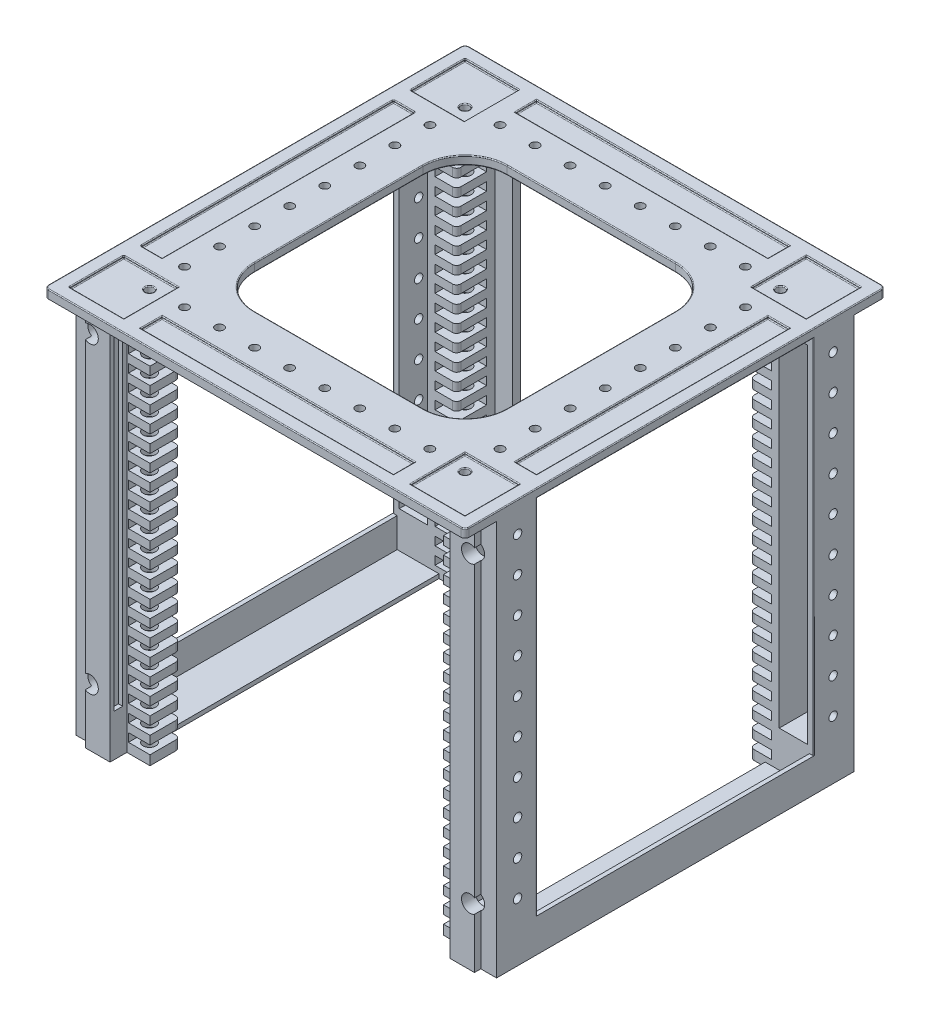
from build123d import *

# Parameters (mm, degrees)
BOSS_EXTRUDE1_DEPTH      = 94
BOSS_EXTRUDE1_2_DEPTH    = 94
BOSS_EXTRUDE1_3_DEPTH    = 94
BOSS_EXTRUDE1_4_DEPTH    = 94
SKETCH4_W                = 100
SKETCH4_H                = 100
BOSS_EXTRUDE2_DEPTH      = 2
FILLET1_R                = 1
SKETCH5_W                = 113.888332388
SKETCH5_H                = 6
CUT_EXTRUDE2_DEPTH       = 140
SKETCH8_W                = 80
SKETCH8_H                = 2
CUT_EXTRUDE5_DEPTH       = 84
LPATTERN1_COUNT          = 23
LPATTERN1_PITCH          = 4
CUT_EXTRUDE6_REACH       = 121.231
SKETCH10_W               = 5.5
SKETCH10_H               = 4
CUT_EXTRUDE7_DEPTH       = 130
SKETCH12_W               = 60
SKETCH12_H               = 60
SKETCH12_H_2             = 5
SKETCH12_W_2             = 5
SKETCH12_W_3             = 12.895913739
SKETCH12_H_3             = 12.895913739
CUT_EXTRUDE8_DEPTH       = 0.5
SKETCH13_W               = 6
SKETCH13_H               = 8
SKETCH13_W_2             = 4
BOSS_EXTRUDE3_DEPTH      = 69.752680626
SKETCH16_W               = 6.697940991
SKETCH16_H               = 82.211539964
CUT_EXTRUDE11_DEPTH      = 6
SKETCH17_W               = 6.28071828
SKETCH17_H               = 82.204451618
CUT_EXTRUDE12_DEPTH      = 6
SKETCH20_R               = 1
CUT_EXTRUDE15_DEPTH      = 4
SKETCH21_R               = 1
CUT_EXTRUDE16_DEPTH      = 4
SKETCH22_R               = 1
CUT_EXTRUDE17_DEPTH      = 4
SKETCH25_W               = 60
SKETCH25_H               = 60
CUT_EXTRUDE18_DEPTH      = 10
FILLET2_R                = 10
SKETCH28_W               = 6.28071828
SKETCH28_H               = 82.204451618
BOSS_EXTRUDE7_DEPTH      = 2
SKETCH29_W               = 6.697940991
SKETCH29_H               = 82.211539964
BOSS_EXTRUDE8_DEPTH      = 2
SKETCH27_W               = 6.28071828
SKETCH27_H               = 82.204451618
BOSS_EXTRUDE9_DEPTH      = 2
SKETCH30_W               = 6.697940991
SKETCH30_H               = 82.211539964
BOSS_EXTRUDE10_DEPTH     = 2
SKETCH31_R               = 1.5
CUT_EXTRUDE19_DEPTH      = 94
FILLET3_R                = 1
SKETCH32_W               = 5
SKETCH32_H               = 65.752680626
CUT_EXTRUDE20_DEPTH      = 7
SKETCH33_W               = 3
SKETCH33_H               = 65.752680626
CUT_EXTRUDE21_DEPTH      = 7
SKETCH34_W               = 65.752680626
SKETCH34_H               = 1
BOSS_EXTRUDE11_DEPTH     = 6
SKETCH35_W               = 65.752680626
SKETCH35_H               = 1
BOSS_EXTRUDE12_DEPTH     = 2
SKETCH36_W               = 4.12
SKETCH36_H               = 79
CUT_EXTRUDE22_DEPTH      = 5
SKETCH37_W               = 4.12
SKETCH37_H               = 79
CUT_EXTRUDE23_DEPTH      = 5
SKETCH38_W               = 2
SKETCH38_H               = 79
CUT_EXTRUDE24_DEPTH      = 1
SKETCH39_W               = 2
SKETCH39_H               = 79
CUT_EXTRUDE25_DEPTH      = 1
SKETCH60_W               = 8.271389359
SKETCH60_H               = 1
BOSS_EXTRUDE27_DEPTH     = 65.752681
SKETCH61_W               = 2.080132297
SKETCH61_H               = 1
BOSS_EXTRUDE28_DEPTH     = 65.752681
CUT_EXTRUDE26_DEPTH      = 150
CUT_EXTRUDE26_DEPTH_BACK = 100
SKETCH62_R               = 2
FILLET4_R                = 0.2


with BuildPart() as part:
    # Sketch3 → Boss-Extrude1 (new body)
    with BuildSketch(Plane(origin=(0, 0, 0), x_dir=(1, 0, 0), z_dir=(0, 1, 0))):
        Polygon((-46.25, 46.25), (-42.5, 46.25), (-42.5, 50), (-34.876340313, 50), (-34.876340313, 45.876340313), (-34.876340313, 34.876340313), (-45.876340313, 34.876340313), (-50, 34.876340313), (-50, 42.5), (-46.25, 42.5), align=None)
    extrude(amount=BOSS_EXTRUDE1_DEPTH)



with BuildPart() as body_2:
    # Sketch3 → Boss-Extrude1 2 (new body)
    with BuildSketch(Plane(origin=(0, 0, 0), x_dir=(1, 0, 0), z_dir=(0, 1, 0))):
        Polygon((50, 34.876340313), (50, 42.5), (46.25, 42.5), (46.25, 46.25), (42.5, 46.25), (42.5, 50), (34.876340313, 50), (34.876340313, 45.876340313), (34.876340313, 34.876340313), (45.876340313, 34.876340313), align=None)
    extrude(amount=BOSS_EXTRUDE1_2_DEPTH)


with BuildPart() as body_3:
    # Sketch3 → Boss-Extrude1 3 (new body)
    with BuildSketch(Plane(origin=(0, 0, 0), x_dir=(1, 0, 0), z_dir=(0, 1, 0))):
        Polygon((46.25, -46.25), (42.5, -46.25), (42.5, -50), (34.876340313, -50), (34.876340313, -45.876340313), (34.876340313, -34.876340313), (45.876340313, -34.876340313), (50, -34.876340313), (50, -42.5), (46.25, -42.5), align=None)
    extrude(amount=BOSS_EXTRUDE1_3_DEPTH)


with BuildPart() as body_4:
    # Sketch3 → Boss-Extrude1 4 (new body)
    with BuildSketch(Plane(origin=(0, 0, 0), x_dir=(1, 0, 0), z_dir=(0, 1, 0))):
        Polygon((-50, -34.876340313), (-50, -42.5), (-46.25, -42.5), (-46.25, -46.25), (-42.5, -46.25), (-42.5, -50), (-34.876340313, -50), (-34.876340313, -45.876340313), (-34.876340313, -34.876340313), (-45.876340313, -34.876340313), align=None)
    extrude(amount=BOSS_EXTRUDE1_4_DEPTH)


with BuildPart() as part_1:
    add(part.part)

    add(body_2.part)  # Boss-Extrude2 merges body 2

    add(body_3.part)  # Boss-Extrude2 merges body 3

    add(body_4.part)  # Boss-Extrude2 merges body 4
    # Sketch4 → Boss-Extrude2 (add)
    with BuildSketch(Plane(origin=(0, 94, 0), x_dir=(1, 0, 0), z_dir=(0, 1, 0))):
        Rectangle(SKETCH4_W, SKETCH4_H)
    extrude(amount=BOSS_EXTRUDE2_DEPTH)

    # Fillet1
    fillet1_edges = [part_1.edges().sort_by_distance(p)[0] for p in [
        (50, 95, 50),
        (50, 95, -50),
        (-50, 95, 50),
        (-50, 95, -50),
    ]]
    fillet(fillet1_edges, radius=FILLET1_R)

    # Sketch5 → Cut-Extrude2 (cut)
    with BuildSketch(Plane(origin=(0, 94, 0), x_dir=(-1, 0, 0), z_dir=(0, -1, 0))):
        with Locations((0, -47)):
            Rectangle(SKETCH5_W, SKETCH5_H)
    extrude(amount=CUT_EXTRUDE2_DEPTH, mode=Mode.SUBTRACT)

    # Sketch8 → Cut-Extrude5 (cut)
    with BuildSketch(Plane.XY.offset(44)):
        with Locations((0, 91.266171096)):
            Rectangle(SKETCH8_W, SKETCH8_H)
    cut_extrude5 = extrude(amount=-CUT_EXTRUDE5_DEPTH, mode=Mode.SUBTRACT)

    # LPattern1: Cut-Extrude5 ×23
    with Locations(*[(0, -i * LPATTERN1_PITCH, 0) for i in range(1, LPATTERN1_COUNT)]):
        add(cut_extrude5, mode=Mode.SUBTRACT)

    # Cut-Extrude6: up to this face of the body (flat: up to its plane)
    cut_extrude6_end = Plane(part_1.part.faces().sort_by_distance((46.860164342, 94, -46.860164342))[0])
    # Sketch10 → Cut-Extrude6 (cut, up to the picked face)
    with BuildSketch(Plane.XZ, mode=Mode.PRIVATE) as cut_extrude6_sk1:
        with Locations((37.626340313, 42)):
            Rectangle(SKETCH10_W, SKETCH10_H)
    cut_extrude6_tool1 = split(extrude(cut_extrude6_sk1.sketch, amount=-CUT_EXTRUDE6_REACH, mode=Mode.PRIVATE), bisect_by=cut_extrude6_end, keep=Keep.BOTH, mode=Mode.PRIVATE)
    # Sketch10 → Cut-Extrude6 (cut, up to the picked face)
    with BuildSketch(Plane.XZ, mode=Mode.PRIVATE) as cut_extrude6_sk2:
        with Locations((-37.626340313, 42)):
            Rectangle(SKETCH10_W, SKETCH10_H)
    cut_extrude6_tool2 = split(extrude(cut_extrude6_sk2.sketch, amount=-CUT_EXTRUDE6_REACH, mode=Mode.PRIVATE), bisect_by=cut_extrude6_end, keep=Keep.BOTH, mode=Mode.PRIVATE)
    add(cut_extrude6_tool1.solids().sort_by(Axis((37.62634, 0, 42), (0, 1, 0)))[0], mode=Mode.SUBTRACT)
    add(cut_extrude6_tool2.solids().sort_by(Axis((-37.62634, 0, 42), (0, 1, 0)))[0], mode=Mode.SUBTRACT)

    # Sketch11 → Cut-Extrude7 (cut)
    with BuildSketch(Plane.XZ.offset(-94)):
        Polygon((0, -48.12), (58.195767775, -48.12), (58.195767775, -50), (0, -50), (-54.824206689, -50), (-54.824206689, -48.12), align=None)
    extrude(amount=CUT_EXTRUDE7_DEPTH, mode=Mode.SUBTRACT)

    # Sketch12 → Cut-Extrude8 (cut)
    with BuildSketch(Plane(origin=(0, 96, 0), x_dir=(1, 0, 0), z_dir=(0, 1, 0))):
        Rectangle(SKETCH12_W, SKETCH12_H)
        with Locations((0, -44.5)):
            Rectangle(SKETCH12_W, SKETCH12_H_2)
        with Locations((-44.5, 0)):
            Rectangle(SKETCH12_W_2, SKETCH12_H)
        with Locations((44.5, 0)):
            Rectangle(SKETCH12_W_2, SKETCH12_H)
        with Locations((0, 44.5)):
            Rectangle(SKETCH12_W, SKETCH12_H_2)
        with Locations((40.55204313, -40.55204313)):
            Rectangle(SKETCH12_W_3, SKETCH12_H_3)
        with Locations((40.55204313, 40.55204313)):
            Rectangle(SKETCH12_W_3, SKETCH12_H_3)
        with Locations((-40.55204313, -40.55204313)):
            Rectangle(SKETCH12_W_3, SKETCH12_H_3)
        with Locations((-40.55204313, 40.55204313)):
            Rectangle(SKETCH12_W_3, SKETCH12_H_3)
    extrude(amount=-CUT_EXTRUDE8_DEPTH, mode=Mode.SUBTRACT)

    # Sketch13 → Boss-Extrude3 (add)
    with BuildSketch(Plane.XY.offset(-34.876340313)):
        with Locations((-47, 4)):
            Rectangle(SKETCH13_W, SKETCH13_H)
        with Locations((48, 4)):
            Rectangle(SKETCH13_W_2, SKETCH13_H)
    extrude(amount=BOSS_EXTRUDE3_DEPTH)

    # Sketch16 → Cut-Extrude11 (cut)
    with BuildSketch(Plane.XY.offset(-34.876340313)):
        with Locations((45.168309976, 50.771451563)):
            Rectangle(SKETCH16_W, SKETCH16_H)
        with Locations((-45.168309976, 50.771451563)):
            Rectangle(SKETCH16_W, SKETCH16_H)
    extrude(amount=-CUT_EXTRUDE11_DEPTH, mode=Mode.SUBTRACT)

    # Sketch17 → Cut-Extrude12 (cut)
    with BuildSketch(Plane(origin=(0, 0, 34.876340313), x_dir=(-1, 0, 0), z_dir=(0, 0, -1))):
        with Locations((-45.078755526, 51)):
            Rectangle(SKETCH17_W, SKETCH17_H)
        with Locations((45.078755526, 51)):
            Rectangle(SKETCH17_W, SKETCH17_H)
    extrude(amount=-CUT_EXTRUDE12_DEPTH, mode=Mode.SUBTRACT)

    # Sketch20 → Cut-Extrude15 (cut)
    with BuildSketch(Plane(origin=(50, 0, 0), x_dir=(0, 0, -1), z_dir=(1, 0, 0))):
        with Locations((-37.5, 80.522257435)):
            Circle(SKETCH20_R)
        with Locations((37.5, 80.522257435)):
            Circle(SKETCH20_R)
        with Locations((-37.5, 72.192257435)):
            Circle(SKETCH20_R)
        with Locations((37.5, 72.192257435)):
            Circle(SKETCH20_R)
        with Locations((-37.5, 63.862257435)):
            Circle(SKETCH20_R)
        with Locations((37.5, 63.862257435)):
            Circle(SKETCH20_R)
        with Locations((-37.5, 55.532257435)):
            Circle(SKETCH20_R)
        with Locations((37.5, 55.532257435)):
            Circle(SKETCH20_R)
        with Locations((-37.5, 47.202257435)):
            Circle(SKETCH20_R)
        with Locations((37.5, 47.202257435)):
            Circle(SKETCH20_R)
        with Locations((-37.5, 38.872257435)):
            Circle(SKETCH20_R)
        with Locations((37.5, 38.872257435)):
            Circle(SKETCH20_R)
        with Locations((-37.5, 30.542257435)):
            Circle(SKETCH20_R)
        with Locations((37.5, 30.542257435)):
            Circle(SKETCH20_R)
        with Locations((-37.5, 22.212257435)):
            Circle(SKETCH20_R)
        with Locations((37.5, 22.212257435)):
            Circle(SKETCH20_R)
        with Locations((-37.5, 13.882257435)):
            Circle(SKETCH20_R)
        with Locations((37.5, 13.882257435)):
            Circle(SKETCH20_R)
        with Locations((37.5, 88.852257435)):
            Circle(SKETCH20_R)
        with Locations((-37.5, 88.852257435)):
            Circle(SKETCH20_R)
    extrude(amount=-CUT_EXTRUDE15_DEPTH, mode=Mode.SUBTRACT)

    # Sketch21 → Cut-Extrude16 (cut)
    with BuildSketch(Plane.ZY.offset(50)):
        with Locations((37.5, 79.760385845)):
            Circle(SKETCH21_R)
        with Locations((-37.5, 79.760385845)):
            Circle(SKETCH21_R)
        with Locations((37.5, 71.427052511)):
            Circle(SKETCH21_R)
        with Locations((-37.5, 71.427052511)):
            Circle(SKETCH21_R)
        with Locations((37.5, 63.093719178)):
            Circle(SKETCH21_R)
        with Locations((-37.5, 63.093719178)):
            Circle(SKETCH21_R)
        with Locations((37.5, 54.760385845)):
            Circle(SKETCH21_R)
        with Locations((-37.5, 54.760385845)):
            Circle(SKETCH21_R)
        with Locations((37.5, 46.427052511)):
            Circle(SKETCH21_R)
        with Locations((-37.5, 46.427052511)):
            Circle(SKETCH21_R)
        with Locations((37.5, 38.093719178)):
            Circle(SKETCH21_R)
        with Locations((-37.5, 38.093719178)):
            Circle(SKETCH21_R)
        with Locations((37.5, 29.760385845)):
            Circle(SKETCH21_R)
        with Locations((-37.5, 29.760385845)):
            Circle(SKETCH21_R)
        with Locations((37.5, 21.427052511)):
            Circle(SKETCH21_R)
        with Locations((-37.5, 21.427052511)):
            Circle(SKETCH21_R)
        with Locations((37.5, 13.093719178)):
            Circle(SKETCH21_R)
        with Locations((-37.5, 13.093719178)):
            Circle(SKETCH21_R)
        with Locations((37.5, 88.093719178)):
            Circle(SKETCH21_R)
        with Locations((-37.5, 88.093719178)):
            Circle(SKETCH21_R)
    extrude(amount=-CUT_EXTRUDE16_DEPTH, mode=Mode.SUBTRACT)

    # Sketch22 → Cut-Extrude17 (cut)
    with BuildSketch(Plane(origin=(0, 96, 0), x_dir=(1, 0, 0), z_dir=(0, 1, 0))):
        with Locations(Location((37.5, -37.5, 0), (0, 0, 270))):
            Circle(SKETCH22_R)
        with Locations(Location((-37.5, -37.5, 0), (0, 0, 270))):
            Circle(SKETCH22_R)
        with Locations(Location((37.5, -29.166666667, 0), (0, 0, 270))):
            Circle(SKETCH22_R)
        with Locations(Location((-37.5, -29.166666667, 0), (0, 0, 270))):
            Circle(SKETCH22_R)
        with Locations(Location((37.5, -20.833333333, 0), (0, 0, 270))):
            Circle(SKETCH22_R)
        with Locations(Location((-37.5, -20.833333333, 0), (0, 0, 270))):
            Circle(SKETCH22_R)
        with Locations(Location((37.5, -12.5, 0), (0, 0, 270))):
            Circle(SKETCH22_R)
        with Locations(Location((-37.5, -12.5, 0), (0, 0, 270))):
            Circle(SKETCH22_R)
        with Locations(Location((37.5, -4.166666667, 0), (0, 0, 270))):
            Circle(SKETCH22_R)
        with Locations(Location((-37.5, -4.166666667, 0), (0, 0, 270))):
            Circle(SKETCH22_R)
        with Locations(Location((37.5, 4.166666667, 0), (0, 0, 270))):
            Circle(SKETCH22_R)
        with Locations(Location((-37.5, 4.166666667, 0), (0, 0, 270))):
            Circle(SKETCH22_R)
        with Locations(Location((37.5, 12.5, 0), (0, 0, 270))):
            Circle(SKETCH22_R)
        with Locations(Location((-37.5, 12.5, 0), (0, 0, 270))):
            Circle(SKETCH22_R)
        with Locations(Location((37.5, 20.833333333, 0), (0, 0, 270))):
            Circle(SKETCH22_R)
        with Locations(Location((-37.5, 20.833333333, 0), (0, 0, 270))):
            Circle(SKETCH22_R)
        with Locations(Location((37.5, 29.166666667, 0), (0, 0, 270))):
            Circle(SKETCH22_R)
        with Locations(Location((-37.5, 29.166666667, 0), (0, 0, 270))):
            Circle(SKETCH22_R)
        with Locations(Location((37.5, 37.5, 0), (0, 0, 270))):
            Circle(SKETCH22_R)
        with Locations(Location((-37.5, 37.5, 0), (0, 0, 270))):
            Circle(SKETCH22_R)
        with Locations(Location((-29.17, -37.5, 0), (0, 0, 270))):
            Circle(SKETCH22_R)
        with Locations(Location((-29.17, 37.5, 0), (0, 0, 270))):
            Circle(SKETCH22_R)
        with Locations(Location((-20.84, -37.5, 0), (0, 0, 270))):
            Circle(SKETCH22_R)
        with Locations(Location((-20.84, 37.5, 0), (0, 0, 270))):
            Circle(SKETCH22_R)
        with Locations(Location((-12.51, -37.5, 0), (0, 0, 270))):
            Circle(SKETCH22_R)
        with Locations(Location((-12.51, 37.5, 0), (0, 0, 270))):
            Circle(SKETCH22_R)
        with Locations(Location((-4.18, -37.5, 0), (0, 0, 270))):
            Circle(SKETCH22_R)
        with Locations(Location((-4.18, 37.5, 0), (0, 0, 270))):
            Circle(SKETCH22_R)
        with Locations(Location((4.15, -37.5, 0), (0, 0, 270))):
            Circle(SKETCH22_R)
        with Locations(Location((4.15, 37.5, 0), (0, 0, 270))):
            Circle(SKETCH22_R)
        with Locations(Location((12.48, -37.5, 0), (0, 0, 270))):
            Circle(SKETCH22_R)
        with Locations(Location((12.48, 37.5, 0), (0, 0, 270))):
            Circle(SKETCH22_R)
        with Locations(Location((20.81, -37.5, 0), (0, 0, 270))):
            Circle(SKETCH22_R)
        with Locations(Location((20.81, 37.5, 0), (0, 0, 270))):
            Circle(SKETCH22_R)
        with Locations(Location((29.14, -37.5, 0), (0, 0, 270))):
            Circle(SKETCH22_R)
        with Locations(Location((29.14, 37.5, 0), (0, 0, 270))):
            Circle(SKETCH22_R)
    extrude(amount=-CUT_EXTRUDE17_DEPTH, mode=Mode.SUBTRACT)

    # Sketch25 → Cut-Extrude18 (cut)
    with BuildSketch(Plane(origin=(0, 95.5, 0), x_dir=(1, 0, 0), z_dir=(0, 1, 0))):
        Rectangle(SKETCH25_W, SKETCH25_H)
    extrude(amount=-CUT_EXTRUDE18_DEPTH, mode=Mode.SUBTRACT)

    # Fillet2
    fillet2_edges = [part_1.edges().sort_by_distance(p)[0] for p in [
        (30, 95, -30),
        (30, 95, 30),
        (-30, 95, 30),
        (-30, 95, -30),
    ]]
    fillet(fillet2_edges, radius=FILLET2_R)

    # Sketch28 → Boss-Extrude7 (add)
    with BuildSketch(Plane(origin=(0, 0, 34.876340313), x_dir=(-1, 0, 0), z_dir=(0, 0, -1))):
        Polygon((44, 0), (44, 8), (50, 8), (50, 94), (34.876340313, 94), (34.876340313, 92.266171096), (40, 92.266171096), (40, 90.266171096), (34.876340313, 90.266171096), (34.876340313, 88.266171096), (40, 88.266171096), (40, 86.266171096), (34.876340313, 86.266171096), (34.876340313, 84.266171096), (40, 84.266171096), (40, 82.266171096), (34.876340313, 82.266171096), (34.876340313, 80.266171096), (40, 80.266171096), (40, 78.266171096), (34.876340313, 78.266171096), (34.876340313, 76.266171096), (40, 76.266171096), (40, 74.266171096), (34.876340313, 74.266171096), (34.876340313, 72.266171096), (40, 72.266171096), (40, 70.266171096), (34.876340313, 70.266171096), (34.876340313, 68.266171096), (40, 68.266171096), (40, 66.266171096), (34.876340313, 66.266171096), (34.876340313, 64.266171096), (40, 64.266171096), (40, 62.266171096), (34.876340313, 62.266171096), (34.876340313, 60.266171096), (40, 60.266171096), (40, 58.266171096), (34.876340313, 58.266171096), (34.876340313, 56.266171096), (40, 56.266171096), (40, 54.266171096), (34.876340313, 54.266171096), (34.876340313, 52.266171096), (40, 52.266171096), (40, 50.266171096), (34.876340313, 50.266171096), (34.876340313, 48.266171096), (40, 48.266171096), (40, 46.266171096), (34.876340313, 46.266171096), (34.876340313, 44.266171096), (40, 44.266171096), (40, 42.266171096), (34.876340313, 42.266171096), (34.876340313, 40.266171096), (40, 40.266171096), (40, 38.266171096), (34.876340313, 38.266171096), (34.876340313, 36.266171096), (40, 36.266171096), (40, 34.266171096), (34.876340313, 34.266171096), (34.876340313, 32.266171096), (40, 32.266171096), (40, 30.266171096), (34.876340313, 30.266171096), (34.876340313, 28.266171096), (40, 28.266171096), (40, 26.266171096), (34.876340313, 26.266171096), (34.876340313, 24.266171096), (40, 24.266171096), (40, 22.266171096), (34.876340313, 22.266171096), (34.876340313, 20.266171096), (40, 20.266171096), (40, 18.266171096), (34.876340313, 18.266171096), (34.876340313, 16.266171096), (40, 16.266171096), (40, 14.266171096), (34.876340313, 14.266171096), (34.876340313, 12.266171096), (40, 12.266171096), (40, 10.266171096), (34.876340313, 10.266171096), (34.876340313, 8.266171096), (40, 8.266171096), (40, 6.266171096), (34.876340313, 6.266171096), (34.876340313, 4.266171096), (40, 4.266171096), (40, 2.266171096), (34.876340313, 2.266171096), (34.876340313, 0), align=None)
        with Locations((45.078755526, 51)):
            Rectangle(SKETCH28_W, SKETCH28_H, mode=Mode.SUBTRACT)
    extrude(amount=BOSS_EXTRUDE7_DEPTH)

    # Sketch29 → Boss-Extrude8 (add)
    with BuildSketch(Plane.XY.offset(-34.876340313)):
        Polygon((-44, 8), (-44, 0), (-34.876340313, 0), (-34.876340313, 2.266171096), (-40, 2.266171096), (-40, 4.266171096), (-34.876340313, 4.266171096), (-34.876340313, 6.266171096), (-40, 6.266171096), (-40, 8.266171096), (-34.876340313, 8.266171096), (-34.876340313, 10.266171096), (-40, 10.266171096), (-40, 12.266171096), (-34.876340313, 12.266171096), (-34.876340313, 14.266171096), (-40, 14.266171096), (-40, 16.266171096), (-34.876340313, 16.266171096), (-34.876340313, 18.266171096), (-40, 18.266171096), (-40, 20.266171096), (-34.876340313, 20.266171096), (-34.876340313, 22.266171096), (-40, 22.266171096), (-40, 24.266171096), (-34.876340313, 24.266171096), (-34.876340313, 26.266171096), (-40, 26.266171096), (-40, 28.266171096), (-34.876340313, 28.266171096), (-34.876340313, 30.266171096), (-40, 30.266171096), (-40, 32.266171096), (-34.876340313, 32.266171096), (-34.876340313, 34.266171096), (-40, 34.266171096), (-40, 36.266171096), (-34.876340313, 36.266171096), (-34.876340313, 38.266171096), (-40, 38.266171096), (-40, 40.266171096), (-34.876340313, 40.266171096), (-34.876340313, 42.266171096), (-40, 42.266171096), (-40, 44.266171096), (-34.876340313, 44.266171096), (-34.876340313, 46.266171096), (-40, 46.266171096), (-40, 48.266171096), (-34.876340313, 48.266171096), (-34.876340313, 50.266171096), (-40, 50.266171096), (-40, 52.266171096), (-34.876340313, 52.266171096), (-34.876340313, 54.266171096), (-40, 54.266171096), (-40, 56.266171096), (-34.876340313, 56.266171096), (-34.876340313, 58.266171096), (-40, 58.266171096), (-40, 60.266171096), (-34.876340313, 60.266171096), (-34.876340313, 62.266171096), (-40, 62.266171096), (-40, 64.266171096), (-34.876340313, 64.266171096), (-34.876340313, 66.266171096), (-40, 66.266171096), (-40, 68.266171096), (-34.876340313, 68.266171096), (-34.876340313, 70.266171096), (-40, 70.266171096), (-40, 72.266171096), (-34.876340313, 72.266171096), (-34.876340313, 74.266171096), (-40, 74.266171096), (-40, 76.266171096), (-34.876340313, 76.266171096), (-34.876340313, 78.266171096), (-40, 78.266171096), (-40, 80.266171096), (-34.876340313, 80.266171096), (-34.876340313, 82.266171096), (-40, 82.266171096), (-40, 84.266171096), (-34.876340313, 84.266171096), (-34.876340313, 86.266171096), (-40, 86.266171096), (-40, 88.266171096), (-34.876340313, 88.266171096), (-34.876340313, 90.266171096), (-40, 90.266171096), (-40, 92.266171096), (-34.876340313, 92.266171096), (-34.876340313, 94), (-50, 94), (-50, 8), align=None)
        with Locations((-45.168309976, 50.771451563)):
            Rectangle(SKETCH29_W, SKETCH29_H, mode=Mode.SUBTRACT)
    extrude(amount=BOSS_EXTRUDE8_DEPTH)

    # Sketch27 → Boss-Extrude9 (add)
    with BuildSketch(Plane(origin=(0, 0, 34.876340313), x_dir=(-1, 0, 0), z_dir=(0, 0, -1))):
        Polygon((-46, 8), (-50, 8), (-50, 94), (-34.876340313, 94), (-34.876340313, 92.266171096), (-40, 92.266171096), (-40, 90.266171096), (-34.876340313, 90.266171096), (-34.876340313, 88.266171096), (-40, 88.266171096), (-40, 86.266171096), (-34.876340313, 86.266171096), (-34.876340313, 84.266171096), (-40, 84.266171096), (-40, 82.266171096), (-34.876340313, 82.266171096), (-34.876340313, 80.266171096), (-40, 80.266171096), (-40, 78.266171096), (-34.876340313, 78.266171096), (-34.876340313, 76.266171096), (-40, 76.266171096), (-40, 74.266171096), (-34.876340313, 74.266171096), (-34.876340313, 72.266171096), (-40, 72.266171096), (-40, 70.266171096), (-34.876340313, 70.266171096), (-34.876340313, 68.266171096), (-40, 68.266171096), (-40, 66.266171096), (-34.876340313, 66.266171096), (-34.876340313, 64.266171096), (-40, 64.266171096), (-40, 62.266171096), (-34.876340313, 62.266171096), (-34.876340313, 60.266171096), (-40, 60.266171096), (-40, 58.266171096), (-34.876340313, 58.266171096), (-34.876340313, 56.266171096), (-40, 56.266171096), (-40, 54.266171096), (-34.876340313, 54.266171096), (-34.876340313, 52.266171096), (-40, 52.266171096), (-40, 50.266171096), (-34.876340313, 50.266171096), (-34.876340313, 48.266171096), (-40, 48.266171096), (-40, 46.266171096), (-34.876340313, 46.266171096), (-34.876340313, 44.266171096), (-40, 44.266171096), (-40, 42.266171096), (-34.876340313, 42.266171096), (-34.876340313, 40.266171096), (-40, 40.266171096), (-40, 38.266171096), (-34.876340313, 38.266171096), (-34.876340313, 36.266171096), (-40, 36.266171096), (-40, 34.266171096), (-34.876340313, 34.266171096), (-34.876340313, 32.266171096), (-40, 32.266171096), (-40, 30.266171096), (-34.876340313, 30.266171096), (-34.876340313, 28.266171096), (-40, 28.266171096), (-40, 26.266171096), (-34.876340313, 26.266171096), (-34.876340313, 24.266171096), (-40, 24.266171096), (-40, 22.266171096), (-34.876340313, 22.266171096), (-34.876340313, 20.266171096), (-40, 20.266171096), (-40, 18.266171096), (-34.876340313, 18.266171096), (-34.876340313, 16.266171096), (-40, 16.266171096), (-40, 14.266171096), (-34.876340313, 14.266171096), (-34.876340313, 12.266171096), (-40, 12.266171096), (-40, 10.266171096), (-34.876340313, 10.266171096), (-34.876340313, 8.266171096), (-40, 8.266171096), (-40, 6.266171096), (-34.876340313, 6.266171096), (-34.876340313, 4.266171096), (-40, 4.266171096), (-40, 2.266171096), (-34.876340313, 2.266171096), (-34.876340313, 0), (-46, 0), align=None)
        with Locations((-45.078755526, 51)):
            Rectangle(SKETCH27_W, SKETCH27_H, mode=Mode.SUBTRACT)
    extrude(amount=BOSS_EXTRUDE9_DEPTH)

    # Sketch30 → Boss-Extrude10 (add)
    with BuildSketch(Plane.XY.offset(-34.876340313)):
        Polygon((46, 8), (50, 8), (50, 94), (34.876340313, 94), (34.876340313, 92.266171096), (40, 92.266171096), (40, 90.266171096), (34.876340313, 90.266171096), (34.876340313, 88.266171096), (40, 88.266171096), (40, 86.266171096), (34.876340313, 86.266171096), (34.876340313, 84.266171096), (40, 84.266171096), (40, 82.266171096), (34.876340313, 82.266171096), (34.876340313, 80.266171096), (40, 80.266171096), (40, 78.266171096), (34.876340313, 78.266171096), (34.876340313, 76.266171096), (40, 76.266171096), (40, 74.266171096), (34.876340313, 74.266171096), (34.876340313, 72.266171096), (40, 72.266171096), (40, 70.266171096), (34.876340313, 70.266171096), (34.876340313, 68.266171096), (40, 68.266171096), (40, 66.266171096), (34.876340313, 66.266171096), (34.876340313, 64.266171096), (40, 64.266171096), (40, 62.266171096), (34.876340313, 62.266171096), (34.876340313, 60.266171096), (40, 60.266171096), (40, 58.266171096), (34.876340313, 58.266171096), (34.876340313, 56.266171096), (40, 56.266171096), (40, 54.266171096), (34.876340313, 54.266171096), (34.876340313, 52.266171096), (40, 52.266171096), (40, 50.266171096), (34.876340313, 50.266171096), (34.876340313, 48.266171096), (40, 48.266171096), (40, 46.266171096), (34.876340313, 46.266171096), (34.876340313, 44.266171096), (40, 44.266171096), (40, 42.266171096), (34.876340313, 42.266171096), (34.876340313, 40.266171096), (40, 40.266171096), (40, 38.266171096), (34.876340313, 38.266171096), (34.876340313, 36.266171096), (40, 36.266171096), (40, 34.266171096), (34.876340313, 34.266171096), (34.876340313, 32.266171096), (40, 32.266171096), (40, 30.266171096), (34.876340313, 30.266171096), (34.876340313, 28.266171096), (40, 28.266171096), (40, 26.266171096), (34.876340313, 26.266171096), (34.876340313, 24.266171096), (40, 24.266171096), (40, 22.266171096), (34.876340313, 22.266171096), (34.876340313, 20.266171096), (40, 20.266171096), (40, 18.266171096), (34.876340313, 18.266171096), (34.876340313, 16.266171096), (40, 16.266171096), (40, 14.266171096), (34.876340313, 14.266171096), (34.876340313, 12.266171096), (40, 12.266171096), (40, 10.266171096), (34.876340313, 10.266171096), (34.876340313, 8.266171096), (40, 8.266171096), (40, 6.266171096), (34.876340313, 6.266171096), (34.876340313, 4.266171096), (40, 4.266171096), (40, 2.266171096), (34.876340313, 2.266171096), (34.876340313, 0), (46, 0), align=None)
        with Locations((45.168309976, 50.771451563)):
            Rectangle(SKETCH30_W, SKETCH30_H, mode=Mode.SUBTRACT)
    extrude(amount=BOSS_EXTRUDE10_DEPTH)

    # Sketch31 → Cut-Extrude19 (cut)
    with BuildSketch(Plane(origin=(0, 0, 0), x_dir=(-1, 0, 0), z_dir=(0, -1, 0))):
        with Locations(Location((-37.5, -37.5, 0), (0, 0, 90))):
            Circle(SKETCH31_R)
        with Locations(Location((37.5, -37.5, 0), (0, 0, 90))):
            Circle(SKETCH31_R)
        with Locations(Location((37.5, 37.5, 0), (0, 0, 90))):
            Circle(SKETCH31_R)
        with Locations(Location((-37.5, 37.5, 0), (0, 0, 90))):
            Circle(SKETCH31_R)
    extrude(amount=-CUT_EXTRUDE19_DEPTH, mode=Mode.SUBTRACT)

    # Fillet3
    fillet3_edges = [part_1.edges().sort_by_distance(p)[0] for p in [
        (34.876340313, 93.133085548, -32.876340313),
        (34.876340313, 89.266171096, -32.876340313),
        (34.876340313, 85.266171096, -32.876340313),
        (34.876340313, 81.266171096, -32.876340313),
        (34.876340313, 77.266171096, -32.876340313),
        (34.876340313, 73.266171096, -32.876340313),
        (34.876340313, 69.266171096, -32.876340313),
        (34.876340313, 65.266171096, -32.876340313),
        (34.876340313, 61.266171096, -32.876340313),
        (34.876340313, 57.266171096, -32.876340313),
        (34.876340313, 53.266171096, -32.876340313),
        (34.876340313, 49.266171096, -32.876340313),
        (34.876340313, 45.266171096, -32.876340313),
        (34.876340313, 41.266171096, -32.876340313),
        (34.876340313, 37.266171096, -32.876340313),
        (34.876340313, 33.266171096, -32.876340313),
        (34.876340313, 29.266171096, -32.876340313),
        (34.876340313, 25.266171096, -32.876340313),
        (34.876340313, 21.266171096, -32.876340313),
        (34.876340313, 17.266171096, -32.876340313),
        (34.876340313, 13.266171096, -32.876340313),
        (34.876340313, 9.266171096, -32.876340313),
        (34.876340313, 5.266171096, -32.876340313),
        (34.876340313, 1.133085548, -32.876340313),
        (-34.876340313, 93.133085548, 32.876340313),
        (-34.876340313, 89.266171096, 32.876340313),
        (-34.876340313, 85.266171096, 32.876340313),
        (-34.876340313, 81.266171096, 32.876340313),
        (-34.876340313, 77.266171096, 32.876340313),
        (-34.876340313, 73.266171096, 32.876340313),
        (-34.876340313, 69.266171096, 32.876340313),
        (-34.876340313, 65.266171096, 32.876340313),
        (-34.876340313, 61.266171096, 32.876340313),
        (-34.876340313, 57.266171096, 32.876340313),
        (-34.876340313, 53.266171096, 32.876340313),
        (-34.876340313, 49.266171096, 32.876340313),
        (-34.876340313, 45.266171096, 32.876340313),
        (-34.876340313, 41.266171096, 32.876340313),
        (-34.876340313, 37.266171096, 32.876340313),
        (-34.876340313, 33.266171096, 32.876340313),
        (-34.876340313, 29.266171096, 32.876340313),
        (-34.876340313, 25.266171096, 32.876340313),
        (-34.876340313, 21.266171096, 32.876340313),
        (-34.876340313, 17.266171096, 32.876340313),
        (-34.876340313, 13.266171096, 32.876340313),
        (-34.876340313, 9.266171096, 32.876340313),
        (-34.876340313, 5.266171096, 32.876340313),
        (-34.876340313, 1.133085548, 32.876340313),
        (34.876340313, 1.133085548, 32.876340313),
        (34.876340313, 33.266171096, 32.876340313),
        (34.876340313, 29.266171096, 32.876340313),
        (34.876340313, 25.266171096, 32.876340313),
        (34.876340313, 21.266171096, 32.876340313),
        (34.876340313, 17.266171096, 32.876340313),
        (34.876340313, 13.266171096, 32.876340313),
        (34.876340313, 5.266171096, 32.876340313),
        (34.876340313, 9.266171096, 32.876340313),
        (34.876340313, 37.266171096, 32.876340313),
        (34.876340313, 41.266171096, 32.876340313),
        (34.876340313, 45.266171096, 32.876340313),
        (34.876340313, 49.266171096, 32.876340313),
        (34.876340313, 53.266171096, 32.876340313),
        (34.876340313, 57.266171096, 32.876340313),
        (34.876340313, 61.266171096, 32.876340313),
        (34.876340313, 65.266171096, 32.876340313),
        (34.876340313, 69.266171096, 32.876340313),
        (34.876340313, 73.266171096, 32.876340313),
        (34.876340313, 77.266171096, 32.876340313),
        (34.876340313, 81.266171096, 32.876340313),
        (34.876340313, 85.266171096, 32.876340313),
        (34.876340313, 89.266171096, 32.876340313),
        (34.876340313, 93.133085548, 32.876340313),
        (-34.876340313, 93.133085548, -32.876340313),
        (-34.876340313, 89.266171096, -32.876340313),
        (-34.876340313, 85.266171096, -32.876340313),
        (-34.876340313, 81.266171096, -32.876340313),
        (-34.876340313, 77.266171096, -32.876340313),
        (-34.876340313, 73.266171096, -32.876340313),
        (-34.876340313, 69.266171096, -32.876340313),
        (-34.876340313, 65.266171096, -32.876340313),
        (-34.876340313, 61.266171096, -32.876340313),
        (-34.876340313, 57.266171096, -32.876340313),
        (-34.876340313, 53.266171096, -32.876340313),
        (-34.876340313, 49.266171096, -32.876340313),
        (-34.876340313, 45.266171096, -32.876340313),
        (-34.876340313, 41.266171096, -32.876340313),
        (-34.876340313, 37.266171096, -32.876340313),
        (-34.876340313, 33.266171096, -32.876340313),
        (-34.876340313, 29.266171096, -32.876340313),
        (-34.876340313, 25.266171096, -32.876340313),
        (-34.876340313, 21.266171096, -32.876340313),
        (-34.876340313, 17.266171096, -32.876340313),
        (-34.876340313, 13.266171096, -32.876340313),
        (-34.876340313, 9.266171096, -32.876340313),
        (-34.876340313, 1.133085548, -32.876340313),
        (-34.876340313, 5.266171096, -32.876340313),
    ]]
    fillet(fillet3_edges, radius=FILLET3_R)

    # Sketch32 → Cut-Extrude20 (cut)
    with BuildSketch(Plane(origin=(0, 8, 0), x_dir=(1, 0, 0), z_dir=(0, 1, 0))):
        with Locations((-46.5, 0)):
            Rectangle(SKETCH32_W, SKETCH32_H)
    extrude(amount=-CUT_EXTRUDE20_DEPTH, mode=Mode.SUBTRACT)

    # Sketch33 → Cut-Extrude21 (cut)
    with BuildSketch(Plane(origin=(0, 8, 0), x_dir=(1, 0, 0), z_dir=(0, 1, 0))):
        with Locations((47.5, 0)):
            Rectangle(SKETCH33_W, SKETCH33_H)
    extrude(amount=-CUT_EXTRUDE21_DEPTH, mode=Mode.SUBTRACT)

    # Sketch34 → Boss-Extrude11 (add)
    with BuildSketch(Plane.ZY.offset(-46)):
        with Locations((0, 0.5)):
            Rectangle(SKETCH34_W, SKETCH34_H)
    extrude(amount=BOSS_EXTRUDE11_DEPTH)

    # Sketch35 → Boss-Extrude12 (add)
    with BuildSketch(Plane(origin=(-44, 0, 0), x_dir=(0, 0, -1), z_dir=(1, 0, 0))):
        with Locations((0, 0.5)):
            Rectangle(SKETCH35_W, SKETCH35_H)
    extrude(amount=BOSS_EXTRUDE12_DEPTH)

    # Sketch36 → Cut-Extrude22 (cut)
    with BuildSketch(Plane.ZY.offset(-34.876340313)):
        with Locations((-44.06, 49.5)):
            Rectangle(SKETCH36_W, SKETCH36_H)
    extrude(amount=-CUT_EXTRUDE22_DEPTH, mode=Mode.SUBTRACT)

    # Sketch37 → Cut-Extrude23 (cut)
    with BuildSketch(Plane(origin=(-34.876340313, 0, 0), x_dir=(0, 0, -1), z_dir=(1, 0, 0))):
        with Locations((44.06, 49.5)):
            Rectangle(SKETCH37_W, SKETCH37_H)
    extrude(amount=-CUT_EXTRUDE23_DEPTH, mode=Mode.SUBTRACT)

    # Sketch38 → Cut-Extrude24 (cut)
    with BuildSketch(Plane.ZY.offset(-40.376340313)):
        with Locations((42, 49.5)):
            Rectangle(SKETCH38_W, SKETCH38_H)
    extrude(amount=-CUT_EXTRUDE24_DEPTH, mode=Mode.SUBTRACT)

    # Sketch39 → Cut-Extrude25 (cut)
    with BuildSketch(Plane(origin=(-40.376340313, 0, 0), x_dir=(0, 0, -1), z_dir=(1, 0, 0))):
        with Locations((-42, 49.5)):
            Rectangle(SKETCH39_W, SKETCH39_H)
    extrude(amount=-CUT_EXTRUDE25_DEPTH, mode=Mode.SUBTRACT)

    # Sketch60 → Boss-Extrude27 (add)
    with BuildSketch(Plane.XY.offset(-32.876340313)):
        with Locations((-43.200018077, 0.5)):
            Rectangle(SKETCH60_W, SKETCH60_H)
    extrude(amount=BOSS_EXTRUDE27_DEPTH)

    # Sketch61 → Boss-Extrude28 (add)
    with BuildSketch(Plane.XY.offset(-32.876340313)):
        with Locations((39.509372279, 0.5)):
            Rectangle(SKETCH61_W, SKETCH61_H)
    extrude(amount=BOSS_EXTRUDE28_DEPTH)

    # Sketch62 → Cut-Extrude26 (cut, two sides: drawn at the far end of the back side and taken through both)
    with BuildSketch(Plane.XY.offset(-40.876340313).offset(-CUT_EXTRUDE26_DEPTH_BACK)):
        with Locations(Location((45.168309977, 85.727221545, 0), (0, 0, 180))):
            Circle(SKETCH62_R)
        with Locations(Location((45.168309977, 13.665681581, 0), (0, 0, 180))):
            Circle(SKETCH62_R)
        with Locations(Location((-45.168309977, 13.665681581, 0), (0, 0, 122.741180998))):
            Circle(SKETCH62_R)
        with Locations(Location((-45.168309977, 85.727221545, 0), (0, 0, 237.258819002))):
            Circle(SKETCH62_R)
    extrude(amount=CUT_EXTRUDE26_DEPTH + CUT_EXTRUDE26_DEPTH_BACK, mode=Mode.SUBTRACT)

    # Fillet4
    fillet4_edges = [part_1.edges().sort_by_distance(p)[0] for p in [
        (-40.55204313, 96, 34.104086261),
        (-40.55204313, 96, -47),
        (-40.55204313, 96, -34.104086261),
        (-42, 96, 0),
        (-44.5, 96, 30),
        (30, 94, 0),
        (27.071067812, 94, 27.071067812),
        (0, 94, 30),
        (-27.071067812, 94, 27.071067812),
        (-30, 94, 0),
        (-27.071067812, 94, -27.071067812),
        (0, 94, -30),
        (-49.707106781, 96, -49.707106781),
        (0, 96, -50),
        (49.707106781, 96, -49.707106781),
        (50, 96, 0),
        (49.707106781, 96, 49.707106781),
        (0, 96, 50),
        (-49.707106781, 96, 49.707106781),
        (-30, 96, 0),
        (-27.071067812, 96, 27.071067812),
        (0, 96, 30),
        (27.071067812, 96, 27.071067812),
        (30, 96, 0),
        (27.071067812, 96, -27.071067812),
        (0, 96, -30),
        (0, 95.5, -47),
        (30, 95.5, -44.5),
        (0, 95.5, -42),
        (-30, 95.5, -44.5),
        (47, 95.5, -40.55204313),
        (40.55204313, 95.5, -34.104086261),
        (34.104086261, 95.5, -40.55204313),
        (40.55204313, 95.5, -47),
        (37.5, 95.5, -38.5),
        (34.104086261, 95.5, 40.55204313),
        (40.55204313, 95.5, 34.104086261),
        (47, 95.5, 40.55204313),
        (40.55204313, 95.5, 47),
        (37.5, 95.5, 36.5),
        (42, 95.5, 0),
        (44.5, 95.5, -30),
        (47, 95.5, 0),
        (44.5, 95.5, 30),
        (0, 95.5, 42),
        (30, 95.5, 44.5),
        (-30, 95.5, 44.5),
        (-47, 95.75, 34.104086261),
        (-47, 95.75, 47),
        (-47, 96, 40.55204313),
        (-34.104086261, 95.5, 40.55204313),
        (-40.55204313, 95.5, 47),
        (-47, 95.5, 40.55204313),
        (-40.55204313, 95.5, 34.104086261),
        (-37.5, 95.5, 36.5),
        (-47, 95.75, -47),
        (-47, 95.75, -34.104086261),
        (-47, 96, -40.55204313),
        (-42, 95.75, -30),
        (-44.5, 96, -30),
        (-47, 95.75, -30),
        (-47, 95.75, 30),
        (-47, 96, 0),
        (-34.104086261, 95.5, -40.55204313),
        (-40.55204313, 95.5, -34.104086261),
        (-47, 95.5, -40.55204313),
        (-40.55204313, 95.5, -47),
        (-44.5, 95.5, -30),
        (-42, 95.5, 0),
        (-44.5, 95.5, 30),
        (-47, 95.5, 0),
        (-50, 51, 32.876340313),
        (-50, 94, 0),
        (-50, 51, -32.876340313),
        (50, 51, -32.876340313),
        (50, 51, 32.876340313),
        (50, 94, 0),
        (-37.5, 95.5, -38.5),
        (-30, 96, -44.5),
        (0, 96, -42),
        (0, 96, -47),
        (30, 96, -44.5),
        (27.071067812, 94, -27.071067812),
        (47, 96, -40.55204313),
        (40.55204313, 96, -47),
        (34.104086261, 96, -40.55204313),
        (40.55204313, 96, -34.104086261),
        (44.5, 96, -30),
        (34.104086261, 96, 40.55204313),
        (40.55204313, 96, 47),
        (40.55204313, 96, 34.104086261),
        (47, 96, 40.55204313),
        (47, 96, 0),
        (44.5, 96, 30),
        (42, 96, 0),
        (0, 96, 47),
        (30, 96, 44.5),
        (0, 95.5, 47),
        (-30, 96, 44.5),
        (0, 96, 42),
        (-34.104086261, 96, 40.55204313),
        (-40.55204313, 96, 47),
        (-50, 96, 0),
        (-27.071067812, 96, -27.071067812),
    ]]
    fillet(fillet4_edges, radius=FILLET4_R)


solid = part_1.part
